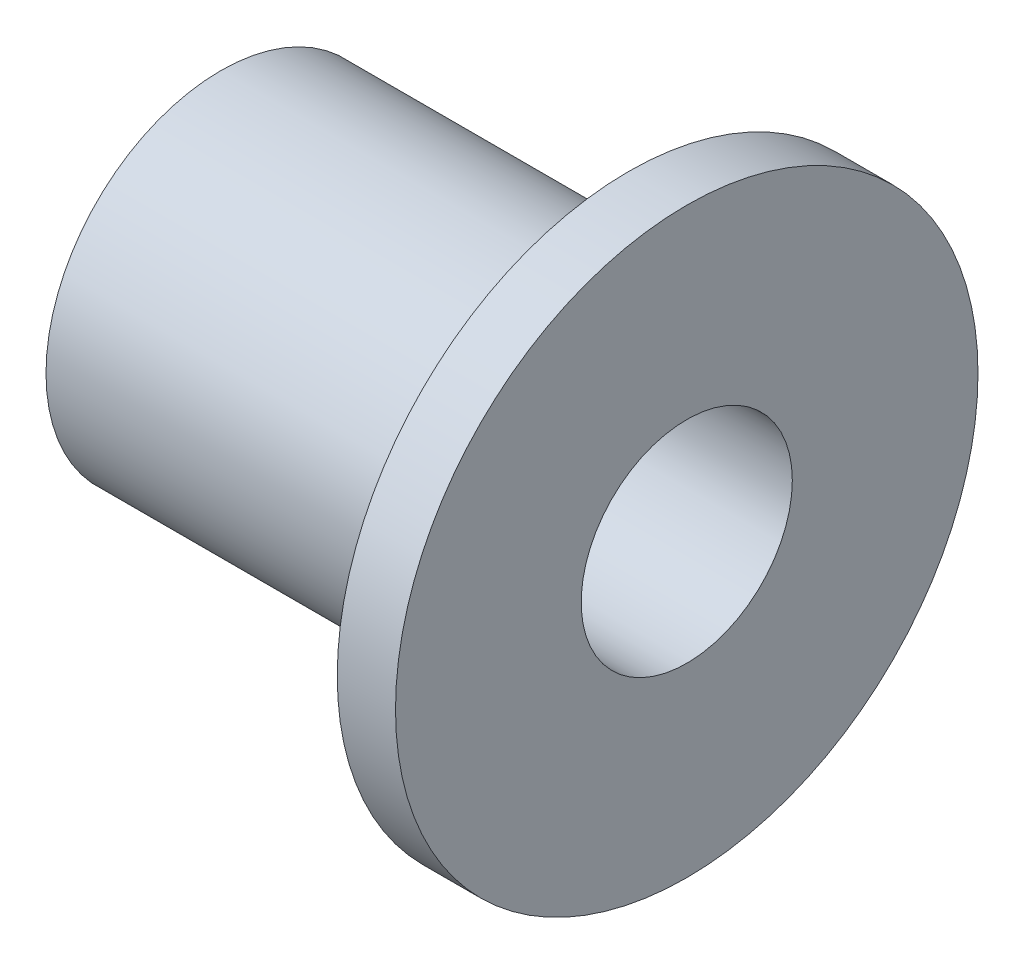
from build123d import *

# Parameters (mm, degrees)
F_1_2_20_TAPPED_HOLE1_D = 11.50874


with BuildPart() as part:
    # Sketch1 → Revolve1 (revolve)
    with BuildSketch(Plane.XY):
        Polygon((0, 9.525), (22.225, 9.525), (22.225, 15.875), (25.4, 15.875), (25.4, 0), (0, 0), align=None)
    revolve(axis=Axis((0, 0, 0), (1, 0, 0)))

    # 1/2-20 Tapped Hole1 (through all)
    with Locations(Plane(origin=(25.4, 0, 0), x_dir=(0, 0, 1), z_dir=(1, 0, 0))):
        with Locations((0, 0)):
            Hole(F_1_2_20_TAPPED_HOLE1_D / 2)


solid = part.part
